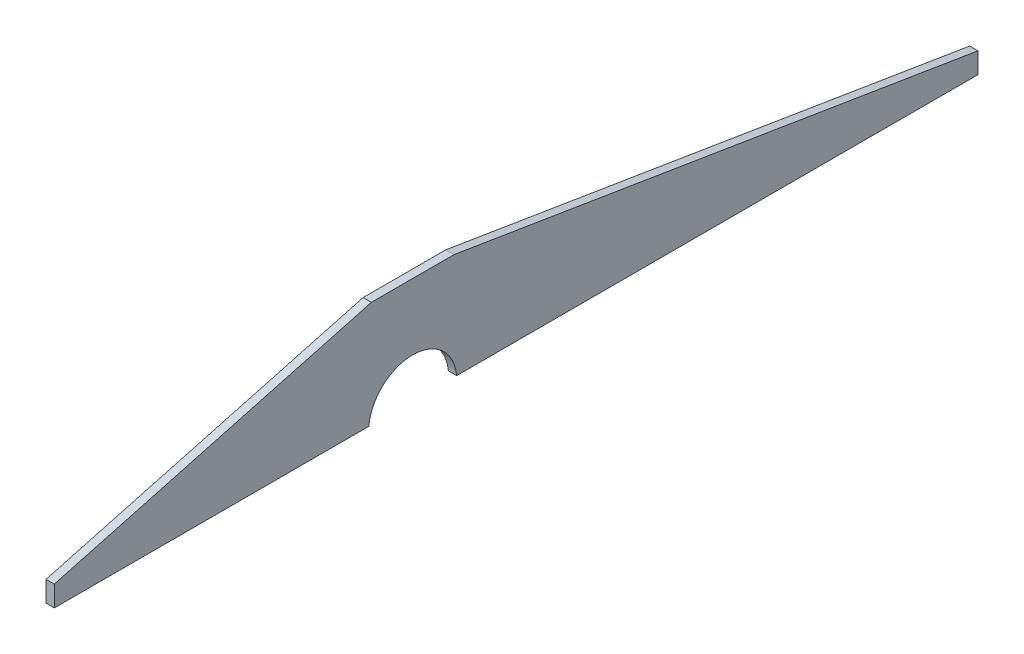
from build123d import *

# Parameters (mm, degrees)
BASE_FLANGE1_DEPTH = 6


# Sheet-metal steps are written as plain solids
with BuildPart() as part:
    # Sketch1 → Base-Flange1 (new body)
    with BuildSketch(Plane(origin=(0, 0, 0), x_dir=(0, 0, -1), z_dir=(1, 0, 0))):
        with BuildLine():
            Line((-31.859064644, 3), (-260, 3))
            Line((-260, 3), (-260, 18))
            Line((-260, 18), (-30, 80))
            Line((-30, 80), (30, 80))
            Line((30, 80), (410, 18))
            Line((410, 18), (410, 3))
            Line((410, 3), (31.859064644, 3))
            ThreePointArc((31.859064644, 3), (0, 32), (-31.859064644, 3))
        make_face()
    extrude(amount=-BASE_FLANGE1_DEPTH)


solid = part.part
